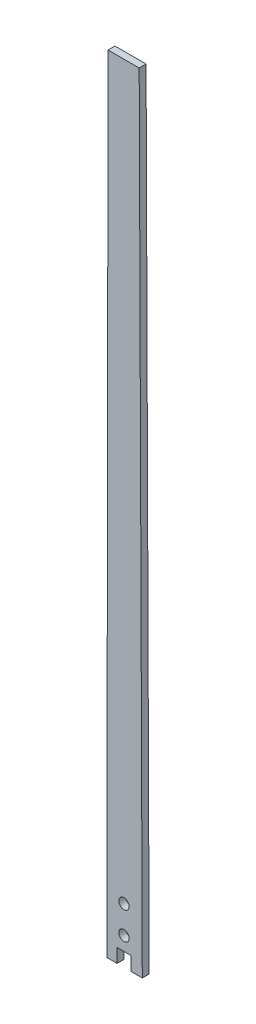
from build123d import *

# Parameters (mm, degrees)
BOSS_EXTRUDE1_DEPTH             = 3.175
CUT_EXTRUDE2_DEPTH              = 401.14632633
CUT_EXTRUDE2_DEPTH_BACK         = 401.14632633
F_3_16_0_1875_DOWEL_HOLE1_D     = 4.7625
F_3_16_0_1875_DOWEL_HOLE1_DEPTH = 10.668
F_3_16_0_1875_DOWEL_HOLE1_TIP   = 1.430799349


with BuildPart() as part:
    # Sketch2 → Boss-Extrude1 (new body)
    with BuildSketch(Plane.XY):
        with BuildLine():
            Line((-5.287084496, 399.996), (9.046416929, 399.996))
            add(Edge.make_bspline(
                [(10.497702226, 29.964324587), (10.357939168, 67.798988725), (10.020154479, 157.802575995), (9.667715008, 247.806107418), (9.322952506, 333.315331774), (9.186064118, 366.65567171), (9.046416929, 399.996)],
                knots=[0, 0, 0, 0, 0.306741018, 0.729695865, 0.729695865, 1, 1, 1, 1], degree=3))
            ThreePointArc((10.497702226, 29.964324587), (2.39840685, 31.659282124), (-5.863797507, 31.203819939))
            add(Edge.make_bspline(
                [(-5.287084496, 399.996), (-5.391975493, 338.602231381), (-5.529538493, 254.095503008), (-5.718143154, 131.164770273), (-5.808631525, 69.627817584), (-5.863797507, 31.203819939)],
                knots=[0, 0, 0, 0, 0.499417718, 0.6874338, 1, 1, 1, 1], degree=3))
        make_face()
    extrude(amount=BOSS_EXTRUDE1_DEPTH)

    # Sketch3 → Cut-Extrude2 (cut, two sides: drawn at the far end of the back side and taken through both)
    with BuildSketch(Plane.XY.offset(-CUT_EXTRUDE2_DEPTH_BACK)):
        Polygon((-9.398, 0), (13.462, 0), (13.462, 38.1), (5.207, 38.1), (5.207, 44.45), (-1.143, 44.45), (-1.143, 38.1), (-9.398, 38.1), align=None)
    extrude(amount=CUT_EXTRUDE2_DEPTH + CUT_EXTRUDE2_DEPTH_BACK, mode=Mode.SUBTRACT)

    # 3/16 (0.1875) Dowel Hole1
    with Locations(Plane.XY.offset(3.175)):
        with Locations((2.032, 50.8), (2.032, 63.5)):
            Hole(F_3_16_0_1875_DOWEL_HOLE1_D / 2, depth=F_3_16_0_1875_DOWEL_HOLE1_DEPTH)
            with Locations((0, 0, -(F_3_16_0_1875_DOWEL_HOLE1_DEPTH + F_3_16_0_1875_DOWEL_HOLE1_TIP / 2))):  # 118° drill point
                Cone(0, F_3_16_0_1875_DOWEL_HOLE1_D / 2, F_3_16_0_1875_DOWEL_HOLE1_TIP, mode=Mode.SUBTRACT)


solid = part.part
